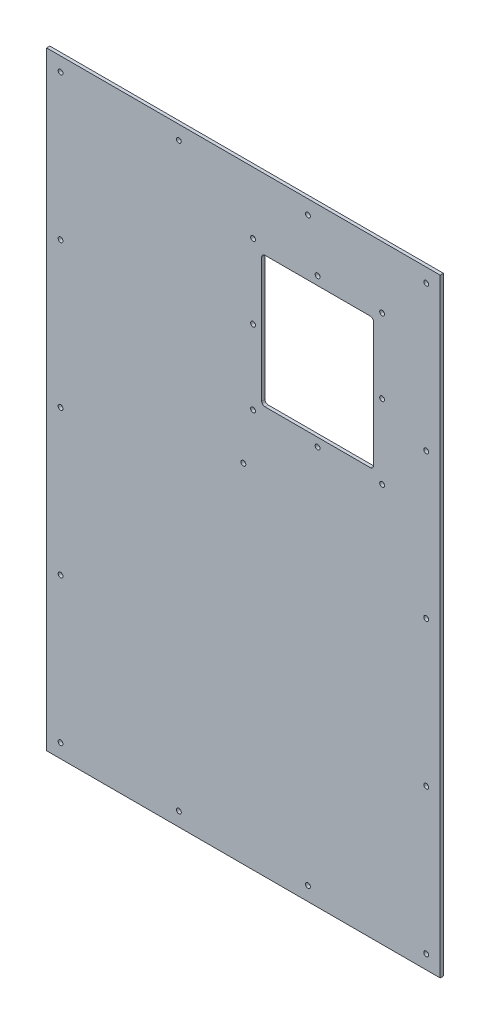
from build123d import *

# Parameters (mm, degrees)
SKETCH_1_W          = 366
SKETCH_1_H          = 566
EXTRUDE_1_DEPTH     = 3
SKETCH_5_R          = 2.25
CUT_EXTRUDE_2_DEPTH = 675.033381963
SKETCH_6_W          = 104
SKETCH_6_H          = 122
CUT_EXTRUDE_3_DEPTH = 675.033381963
SKETCH_7_R          = 2.25
CUT_EXTRUDE_4_DEPTH = 675.033381963
SKETCH1_R           = 2.25
CUT_EXTRUDE1_DEPTH  = 675.033381963
FILLET2_R           = 3


with BuildPart() as part:
    # Эскиз1 → Бобышка-Вытянуть1 (new body)
    with BuildSketch(Plane.XY):
        with Locations((183, 283)):
            Rectangle(SKETCH_1_W, SKETCH_1_H)
    extrude(amount=EXTRUDE_1_DEPTH)

    # Эскиз5 → Вырез-Вытянуть2 (cut, through all)
    with BuildSketch(Plane(origin=(0, 0, 0), x_dir=(-1, 0, 0), z_dir=(0, 0, -1))):
        with Locations((-353, 553)):
            Circle(SKETCH_5_R)
        with Locations((-13, 553)):
            Circle(SKETCH_5_R)
        with Locations((-243, 553)):
            Circle(SKETCH_5_R)
        with Locations((-123, 553)):
            Circle(SKETCH_5_R)
        with Locations((-353, 418)):
            Circle(SKETCH_5_R)
        with Locations((-353, 283)):
            Circle(SKETCH_5_R)
        with Locations((-353, 148)):
            Circle(SKETCH_5_R)
        with Locations((-353, 13)):
            Circle(SKETCH_5_R)
        with Locations((-13, 418)):
            Circle(SKETCH_5_R)
        with Locations((-13, 283)):
            Circle(SKETCH_5_R)
        with Locations((-13, 148)):
            Circle(SKETCH_5_R)
        with Locations((-13, 13)):
            Circle(SKETCH_5_R)
        with Locations((-123, 13)):
            Circle(SKETCH_5_R)
        with Locations((-243, 13)):
            Circle(SKETCH_5_R)
    extrude(amount=-CUT_EXTRUDE_2_DEPTH, mode=Mode.SUBTRACT)

    # Эскиз6 → Вырез-Вытянуть3 (cut, through all)
    with BuildSketch(Plane.XY.offset(3)):
        with Locations((252, 439.5)):
            Rectangle(SKETCH_6_W, SKETCH_6_H)
    extrude(amount=-CUT_EXTRUDE_3_DEPTH, mode=Mode.SUBTRACT)

    # Эскиз7 → Вырез-Вытянуть4 (cut, through all)
    with BuildSketch(Plane.XY.offset(3)):
        with Locations((192, 370.5)):
            Circle(SKETCH_7_R)
        with Locations((192, 439.5)):
            Circle(SKETCH_7_R)
        with Locations((192, 508.5)):
            Circle(SKETCH_7_R)
        with Locations((252, 370.5)):
            Circle(SKETCH_7_R)
        with Locations((312, 370.5)):
            Circle(SKETCH_7_R)
        with Locations((252, 508.5)):
            Circle(SKETCH_7_R)
        with Locations((312, 508.5)):
            Circle(SKETCH_7_R)
        with Locations((312, 439.5)):
            Circle(SKETCH_7_R)
    extrude(amount=-CUT_EXTRUDE_4_DEPTH, mode=Mode.SUBTRACT)

    # Sketch1 → Cut-Extrude1 (cut, through all)
    with BuildSketch(Plane.XY.offset(3)):
        with Locations((183, 323)):
            Circle(SKETCH1_R)
    extrude(amount=-CUT_EXTRUDE1_DEPTH, mode=Mode.SUBTRACT)

    # Fillet2
    fillet2_edges = [part.edges().sort_by_distance(p)[0] for p in [
        (200, 378.5, 1.5),
        (304, 378.5, 1.5),
        (304, 500.5, 1.5),
        (200, 500.5, 1.5),
    ]]
    fillet(fillet2_edges, radius=FILLET2_R)


solid = part.part
